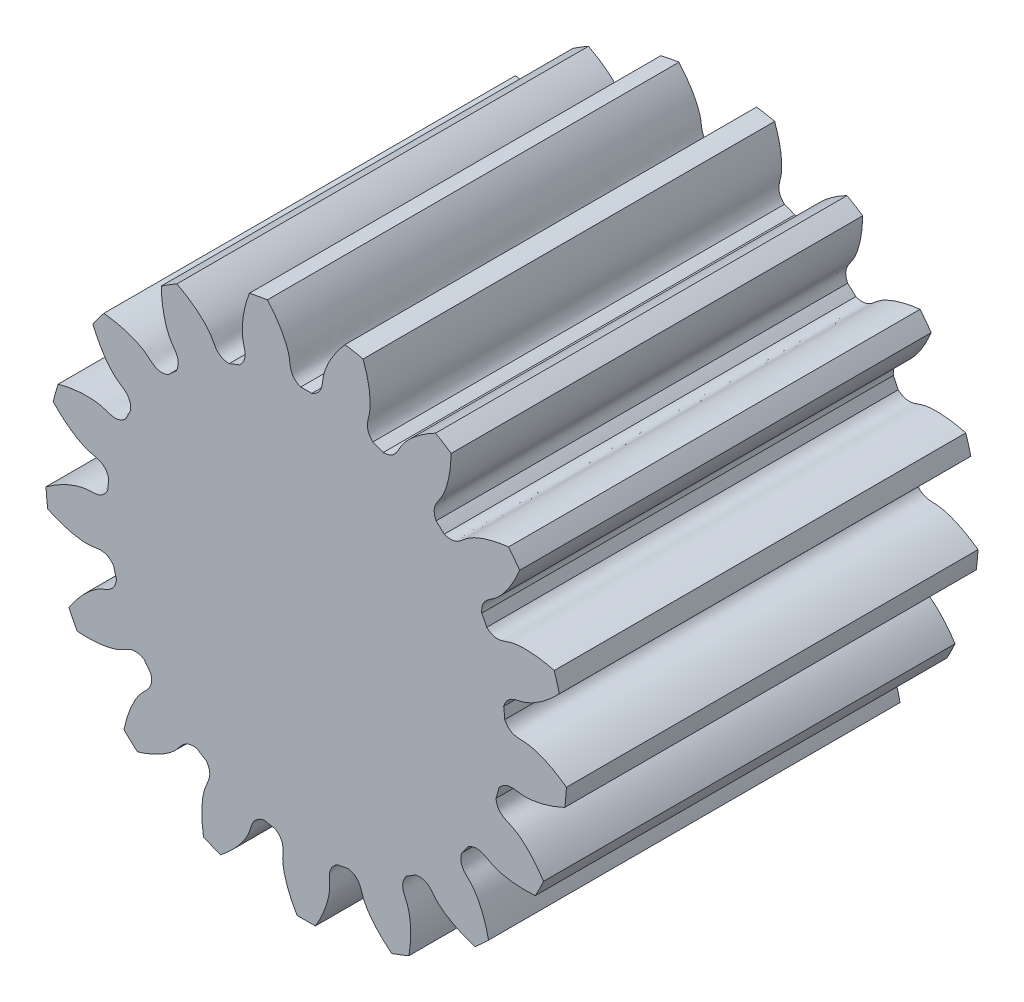
from build123d import *

# Parameters (mm, degrees)
SKETCH_1_R               = 19
EXTRUDE_1_DEPTH          = 30
CUT_EXTRUDE_1_DEPTH      = 41.274061131
PATTERN_CIRCULAR_1_COUNT = 17


with BuildPart() as part:
    # 草图1 → 凸台-拉伸1 (new body)
    with BuildSketch(Plane.XY):
        Circle(SKETCH_1_R)
    extrude(amount=EXTRUDE_1_DEPTH)

    # 草图2 → 切除-拉伸1 (cut, through all)
    with BuildSketch(Plane.XY):
        with BuildLine():
            ThreePointArc((0.403387494, 14.494387829), (0, 14.5), (-0.403387494, 14.494387829))
            add(Edge.make_bspline(
                [(-0.403387494, 14.494387829), (-1.255759481, 14.849644042), (-1.132390756, 15.509626813), (-1.276611209, 16.129648275), (-1.289951469, 16.18230119), (-1.306037005, 16.240838627), (-1.32510118, 16.305170665), (-1.347383555, 16.375198727), (-1.373118159, 16.450817515), (-1.40253689, 16.531914502), (-1.435868224, 16.618370188), (-1.473337358, 16.710058129), (-1.515165928, 16.80684504), (-1.561571855, 16.908590882), (-1.612769151, 17.015148962), (-1.66896775, 17.12636603), (-1.730373323, 17.242082389), (-1.797187111, 17.362132), (-1.869605751, 17.4863426), (-1.947821109, 17.61453582), (-2.032020115, 17.746527309), (-2.1223846, 17.882126855), (-2.219091138, 18.021138524), (-2.32231089, 18.163360791), (-2.432209452, 18.308586678), (-2.548946705, 18.456603899), (-2.67267667, 18.607195006), (-2.803547366, 18.760137539), (-2.941700674, 18.915204179), (-3.087272199, 19.072162909), (-3.24039114, 19.23077717), (-3.401180166, 19.390806026), (-3.569755292, 19.552004336), (-3.746225758, 19.71412292), (-3.930693918, 19.876908731), (-4.123255131, 20.040105038), (-4.323997649, 20.203451599), (-4.533002522, 20.366684847), (-4.750343497, 20.529538073), (-4.976086928, 20.691741613), (-5.210291694, 20.853023038), (-5.453009069, 21.013107349), (-5.79164327, 21.226861067), (-6.053153804, 21.381051942), (-6.231291666, 21.481438237)],
                knots=[0, 0, 0, 0, 0.193882922, 0.199023975, 0.204850501, 0.211362501, 0.218559975, 0.226442923, 0.235011345, 0.24426524, 0.254204608, 0.264829451, 0.276139767, 0.288135557, 0.300816821, 0.314183558, 0.328235769, 0.342973453, 0.358396612, 0.374505244, 0.39129935, 0.408778929, 0.426943982, 0.445794509, 0.46533051, 0.485551984, 0.506458932, 0.528051354, 0.550329249, 0.573292619, 0.596941461, 0.621275778, 0.646295568, 0.672000832, 0.69839157, 0.725467781, 0.753229466, 0.781676625, 0.810809257, 0.840627364, 0.871130943, 0.902319997, 0.934194524, 1, 1, 1, 1], degree=3))
            ThreePointArc((-6.231291666, 21.481438237), (0, 22.366966369), (6.231291666, 21.481438237))
            add(Edge.make_bspline(
                [(0.403387494, 14.494387829), (1.255759481, 14.849644042), (1.132390756, 15.509626813), (1.276611209, 16.129648275), (1.289951469, 16.18230119), (1.306037005, 16.240838627), (1.32510118, 16.305170665), (1.347383555, 16.375198727), (1.373118159, 16.450817515), (1.40253689, 16.531914502), (1.435868224, 16.618370188), (1.473337358, 16.710058129), (1.515165928, 16.80684504), (1.561571855, 16.908590882), (1.612769151, 17.015148962), (1.66896775, 17.12636603), (1.730373323, 17.242082389), (1.797187111, 17.362132), (1.869605751, 17.4863426), (1.947821109, 17.61453582), (2.032020115, 17.746527309), (2.1223846, 17.882126855), (2.219091138, 18.021138524), (2.32231089, 18.163360791), (2.432209452, 18.308586678), (2.548946705, 18.456603899), (2.67267667, 18.607195006), (2.803547366, 18.760137539), (2.941700674, 18.915204179), (3.087272199, 19.072162909), (3.24039114, 19.23077717), (3.401180166, 19.390806026), (3.569755292, 19.552004336), (3.746225758, 19.71412292), (3.930693918, 19.876908731), (4.123255131, 20.040105038), (4.323997649, 20.203451599), (4.533002522, 20.366684847), (4.750343497, 20.529538073), (4.976086928, 20.691741613), (5.210291694, 20.853023038), (5.453009069, 21.013107349), (5.79164327, 21.226861067), (6.053153804, 21.381051942), (6.231291666, 21.481438237)],
                knots=[0, 0, 0, 0, 0.193882922, 0.199023975, 0.204850501, 0.211362501, 0.218559975, 0.226442923, 0.235011345, 0.24426524, 0.254204608, 0.264829451, 0.276139767, 0.288135557, 0.300816821, 0.314183558, 0.328235769, 0.342973453, 0.358396612, 0.374505244, 0.39129935, 0.408778929, 0.426943982, 0.445794509, 0.46533051, 0.485551984, 0.506458932, 0.528051354, 0.550329249, 0.573292619, 0.596941461, 0.621275778, 0.646295568, 0.672000832, 0.69839157, 0.725467781, 0.753229466, 0.781676625, 0.810809257, 0.840627364, 0.871130943, 0.902319997, 0.934194524, 1, 1, 1, 1], degree=3))
        make_face()
    cut_extrude_1 = extrude(amount=CUT_EXTRUDE_1_DEPTH, mode=Mode.SUBTRACT)

    # 阵列(圆周)1: 切除-拉伸1 ×17 about axis
    pattern_circular_1_axis = Axis((0, 0, -1.5), (0, 0, 1))
    for i in range(1, PATTERN_CIRCULAR_1_COUNT):
        add(cut_extrude_1.rotate(pattern_circular_1_axis, i * 360 / PATTERN_CIRCULAR_1_COUNT), mode=Mode.SUBTRACT)


solid = part.part
